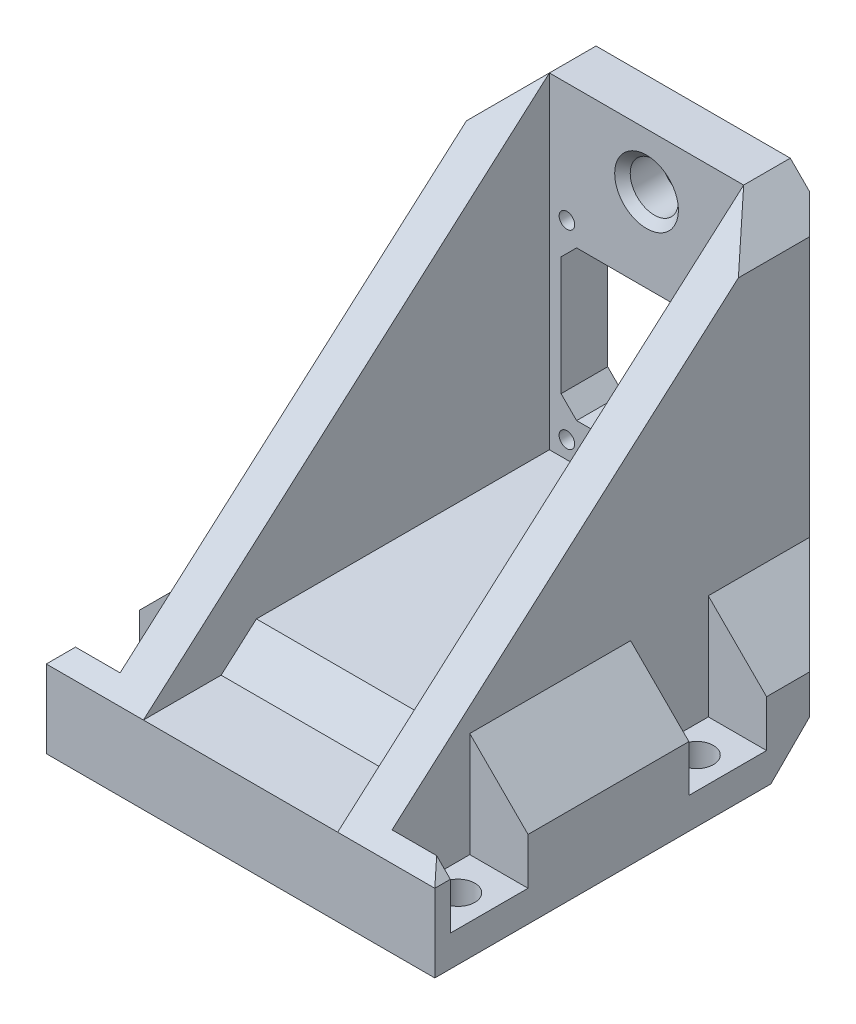
from build123d import *

# Parameters (mm, degrees)
SKETCH1_W               = 50
SKETCH1_H               = 58.25
BOSS_EXTRUDE1_DEPTH     = 10
SKETCH2_R               = 2.15
CUT_EXTRUDE1_DEPTH      = 4
SKETCH5_W               = 25
SKETCH5_H               = 6
BOSS_EXTRUDE3_DEPTH     = 46
CUT_EXTRUDE3_REACH      = 86.582
SKETCH6_W               = 22
SKETCH6_H               = 19.25
SKETCH7_R               = 1
CUT_EXTRUDE4_DEPTH      = 2.5
CUT_EXTRUDE5_REACH      = 84.21
SKETCH8_R               = 2
BOSS_EXTRUDE4_DEPTH     = 5
CHAMFER1_SIZE           = 7.5
CHAMFER2_SIZE           = 10
CHAMFER4_SIZE           = 15
CHAMFER5_SIZE           = 5
CHAMFER7_SIZE           = 2
CUT_EXTRUDE6_REACH      = 86.582
SKETCH10_R              = 3.1
CHAMFER8_SIZE           = 1
BOSS_EXTRUDE5_REACH     = 75.42
CUT_EXTRUDE12_REACH     = 78.095
SKETCH17_W              = 10
SKETCH17_H              = 13.5
LPATTERN1_COUNT         = 2
LPATTERN1_PITCH         = 30.7
MIRROR3_COPY_1_REACH    = 78.095
MIRROR3_COPY_1_SKETCH_W = 10
MIRROR3_COPY_1_SKETCH_H = 13.5


# Some blends are built 0.0001 mm under size
with BuildPart() as part:
    # Sketch1 → Boss-Extrude1 (new body)
    with BuildSketch(Plane(origin=(0, 0, 0), x_dir=(1, 0, 0), z_dir=(0, 1, 0))):
        Rectangle(SKETCH1_W, SKETCH1_H)
    extrude(amount=BOSS_EXTRUDE1_DEPTH)

    # Sketch2 → Cut-Extrude1 (cut)
    with BuildSketch(Plane(origin=(0, 0, 0), x_dir=(1, 0, 0), z_dir=(0, 1, 0))):
        with Locations(Location((-21, 8.575, 0), (0, 0, 270))):
            Circle(SKETCH2_R)
        with Locations(Location((-21, -22.125, 0), (0, 0, 270))):
            Circle(SKETCH2_R)
        with Locations(Location((21, 8.575, 0), (0, 0, 270))):
            Circle(SKETCH2_R)
        with Locations(Location((21, -22.125, 0), (0, 0, 270))):
            Circle(SKETCH2_R)
    extrude(amount=CUT_EXTRUDE1_DEPTH, mode=Mode.SUBTRACT)

    # Sketch5 → Boss-Extrude3 (add)
    with BuildSketch(Plane(origin=(0, 10, 0), x_dir=(1, 0, 0), z_dir=(0, 1, 0))):
        with Locations((0, 26.125)):
            Rectangle(SKETCH5_W, SKETCH5_H)
    extrude(amount=BOSS_EXTRUDE3_DEPTH)

    # Sketch6 → Cut-Extrude3 (cut, up to next)
    with BuildSketch(Plane(origin=(0, 0, -29.125), x_dir=(-1, 0, 0), z_dir=(0, 0, -1)), mode=Mode.PRIVATE) as cut_extrude3_sk1:
        with Locations((0, 28.625)):
            Rectangle(SKETCH6_W, SKETCH6_H)
    cut_extrude3_tool1 = extrude(cut_extrude3_sk1.sketch, amount=-CUT_EXTRUDE3_REACH, mode=Mode.PRIVATE) & part.part
    add(cut_extrude3_tool1.solids().sort_by_distance((0, 28.625, -29.125))[0], mode=Mode.SUBTRACT)

    # Sketch7 → Cut-Extrude4 (cut)
    with BuildSketch(Plane.XY.offset(-23.125)):
        with Locations((10.25, 16.25)):
            Circle(SKETCH7_R)
        with Locations((-10.25, 16.25)):
            Circle(SKETCH7_R)
        with Locations((-10.25, 40.7)):
            Circle(SKETCH7_R)
        with Locations((10.25, 40.7)):
            Circle(SKETCH7_R)
    extrude(amount=-CUT_EXTRUDE4_DEPTH, mode=Mode.SUBTRACT)

    # Sketch8 → Cut-Extrude5 (cut, up to next)
    with BuildSketch(Plane.XY.offset(-25.625), mode=Mode.PRIVATE) as cut_extrude5_sk1:
        with Locations((-10.25, 40.7)):
            Circle(SKETCH8_R)
    cut_extrude5_tool1 = extrude(cut_extrude5_sk1.sketch, amount=-CUT_EXTRUDE5_REACH, mode=Mode.PRIVATE) & part.part
    # Sketch8 → Cut-Extrude5 (cut, up to next)
    with BuildSketch(Plane.XY.offset(-25.625), mode=Mode.PRIVATE) as cut_extrude5_sk2:
        with Locations((10.25, 40.7)):
            Circle(SKETCH8_R)
    cut_extrude5_tool2 = extrude(cut_extrude5_sk2.sketch, amount=-CUT_EXTRUDE5_REACH, mode=Mode.PRIVATE) & part.part
    # Sketch8 → Cut-Extrude5 (cut, up to next)
    with BuildSketch(Plane.XY.offset(-25.625), mode=Mode.PRIVATE) as cut_extrude5_sk3:
        with Locations((10.25, 16.25)):
            Circle(SKETCH8_R)
    cut_extrude5_tool3 = extrude(cut_extrude5_sk3.sketch, amount=-CUT_EXTRUDE5_REACH, mode=Mode.PRIVATE) & part.part
    # Sketch8 → Cut-Extrude5 (cut, up to next)
    with BuildSketch(Plane.XY.offset(-25.625), mode=Mode.PRIVATE) as cut_extrude5_sk4:
        with Locations((-10.25, 16.25)):
            Circle(SKETCH8_R)
    cut_extrude5_tool4 = extrude(cut_extrude5_sk4.sketch, amount=-CUT_EXTRUDE5_REACH, mode=Mode.PRIVATE) & part.part
    add(cut_extrude5_tool1.solids().sort_by_distance((-10.25, 40.7, -25.625))[0], mode=Mode.SUBTRACT)
    add(cut_extrude5_tool2.solids().sort_by_distance((10.25, 40.7, -25.625))[0], mode=Mode.SUBTRACT)
    add(cut_extrude5_tool3.solids().sort_by_distance((10.25, 16.25, -25.625))[0], mode=Mode.SUBTRACT)
    add(cut_extrude5_tool4.solids().sort_by_distance((-10.25, 16.25, -25.625))[0], mode=Mode.SUBTRACT)

    # Sketch9 → Boss-Extrude4 (add)
    with BuildSketch(Plane(origin=(12.5, 0, 0), x_dir=(0, 0, -1), z_dir=(1, 0, 0))):
        Polygon((29.125, 56), (23.125, 56), (-29.125, 10), (29.125, 10), align=None)
    boss_extrude4 = extrude(amount=BOSS_EXTRUDE4_DEPTH)

    # Mirror1: Boss-Extrude4 across plane
    add(boss_extrude4.mirror(Plane(origin=(0, 0, 0), x_dir=(0, 0, 1), z_dir=(1, 0, 0))))

    # Chamfer1
    chamfer1_edges = [part.edges().sort_by_distance(p)[0] for p in [
        (17.5, 10, 0),
        (-17.5, 10, 0),
    ]]
    chamfer(chamfer1_edges, length=CHAMFER1_SIZE - 0.0001)  # a hair under: the kernel refuses the full size

    # Chamfer2
    chamfer2_edges = [part.edges().sort_by_distance(p)[0] for p in [
        (-25, 5, -29.125),
        (25, 5, -29.125),
    ]]
    chamfer(chamfer2_edges, length=CHAMFER2_SIZE)

    # Chamfer4
    # the kernel refuses this chamfer: 15 mm, written as the material it takes off along each edge
    with BuildSketch(Plane(origin=(-53.575244819, 0, -29.125), x_dir=(0, 0.9996219169112968, -0.02749587661058632), z_dir=(1, 0, 0))) as chamfer4_piece_1:
        Polygon((CHAMFER4_SIZE * 0.999621916911, CHAMFER4_SIZE * 0.0274958766106), (-CHAMFER4_SIZE * 0.0274958766106, CHAMFER4_SIZE * 0.999621916911), (0, 0), align=None)
    extrude(amount=107.150489639, mode=Mode.SUBTRACT)

    # Chamfer5
    chamfer5_edges = [part.edges().sort_by_distance(p)[0] for p in [
        (17.5, 56, -24.875),
        (-17.5, 56, -24.875),
    ]]
    chamfer(chamfer5_edges, length=CHAMFER5_SIZE)

    # Chamfer7
    chamfer7_edges = [part.edges().sort_by_distance(p)[0] for p in [
        (-11, 38.25, -26.125),
        (-11, 19, -26.125),
        (11, 19, -26.125),
        (11, 38.25, -26.125),
    ]]
    chamfer(chamfer7_edges, length=CHAMFER7_SIZE)

    # Sketch10 → Cut-Extrude6 (cut, up to next)
    with BuildSketch(Plane(origin=(0, 0, -29.125), x_dir=(-1, 0, 0), z_dir=(0, 0, -1)), mode=Mode.PRIVATE) as cut_extrude6_sk1:
        with Locations((0, 49)):
            Circle(SKETCH10_R)
    cut_extrude6_tool1 = extrude(cut_extrude6_sk1.sketch, amount=-CUT_EXTRUDE6_REACH, mode=Mode.PRIVATE) & part.part
    add(cut_extrude6_tool1.solids().sort_by_distance((0, 49, -29.125))[0], mode=Mode.SUBTRACT)

    # Chamfer8
    chamfer8_edges = [part.edges().sort_by_distance(p)[0] for p in [
        (3.1, 49, -29.125),
        (3.1, 49, -23.125),
    ]]
    chamfer(chamfer8_edges, length=CHAMFER8_SIZE)

    # Sketch11 → Boss-Extrude5 (add, up to next)
    with BuildSketch(Plane(origin=(-12.5, 0, 0), x_dir=(0, 0, -1), z_dir=(1, 0, 0)), mode=Mode.PRIVATE) as boss_extrude5_sk1:
        Polygon((-19.125, 10), (23.125, 10), (23.125, 14), (-14.581521739, 14), align=None)
    boss_extrude5_tool1 = extrude(boss_extrude5_sk1.sketch, amount=BOSS_EXTRUDE5_REACH, mode=Mode.PRIVATE) - part.part
    add(boss_extrude5_tool1.solids().sort_by_distance((-12.5, 11.962117, -3.114355))[0])

    # Sketch17 → Cut-Extrude12 (cut, up to next)
    with BuildSketch(Plane(origin=(17.5, 0, 0), x_dir=(0, 0, -1), z_dir=(1, 0, 0)), mode=Mode.PRIVATE) as cut_extrude12_sk1:
        with Locations((8.575, 10.75)):
            Rectangle(SKETCH17_W, SKETCH17_H)
    cut_extrude12_tool1 = extrude(cut_extrude12_sk1.sketch, amount=CUT_EXTRUDE12_REACH, mode=Mode.PRIVATE) & part.part
    cut_extrude12 = cut_extrude12_tool1.solids().sort_by_distance((17.5, 10.75, -8.575))[0]
    add(cut_extrude12, mode=Mode.SUBTRACT)

    # LPattern1: Cut-Extrude12 ×2
    with Locations(*[(0, 0, i * LPATTERN1_PITCH) for i in range(1, LPATTERN1_COUNT)]):
        add(cut_extrude12, mode=Mode.SUBTRACT)

    # Mirror3: Cut-Extrude12 across plane
    add(cut_extrude12.mirror(Plane(origin=(0, 0, 0), x_dir=(0, 0, 1), z_dir=(1, 0, 0))), mode=Mode.SUBTRACT)

    # Mirror3 copy 1 sketch → Mirror3 copy 1 (cut, up to next)
    with BuildSketch(Plane(origin=(-17.5, 0, 30.7), x_dir=(0, 0, -1), z_dir=(-1, 0, 0)), mode=Mode.PRIVATE) as mirror3_copy_1_sk1:
        with Locations((8.575, -10.75)):
            Rectangle(MIRROR3_COPY_1_SKETCH_W, MIRROR3_COPY_1_SKETCH_H)
    mirror3_copy_1_tool1 = extrude(mirror3_copy_1_sk1.sketch, amount=MIRROR3_COPY_1_REACH, mode=Mode.PRIVATE) & part.part
    add(mirror3_copy_1_tool1.solids().sort_by_distance((-17.5, 10.75, 22.125))[0], mode=Mode.SUBTRACT)


solid = part.part
